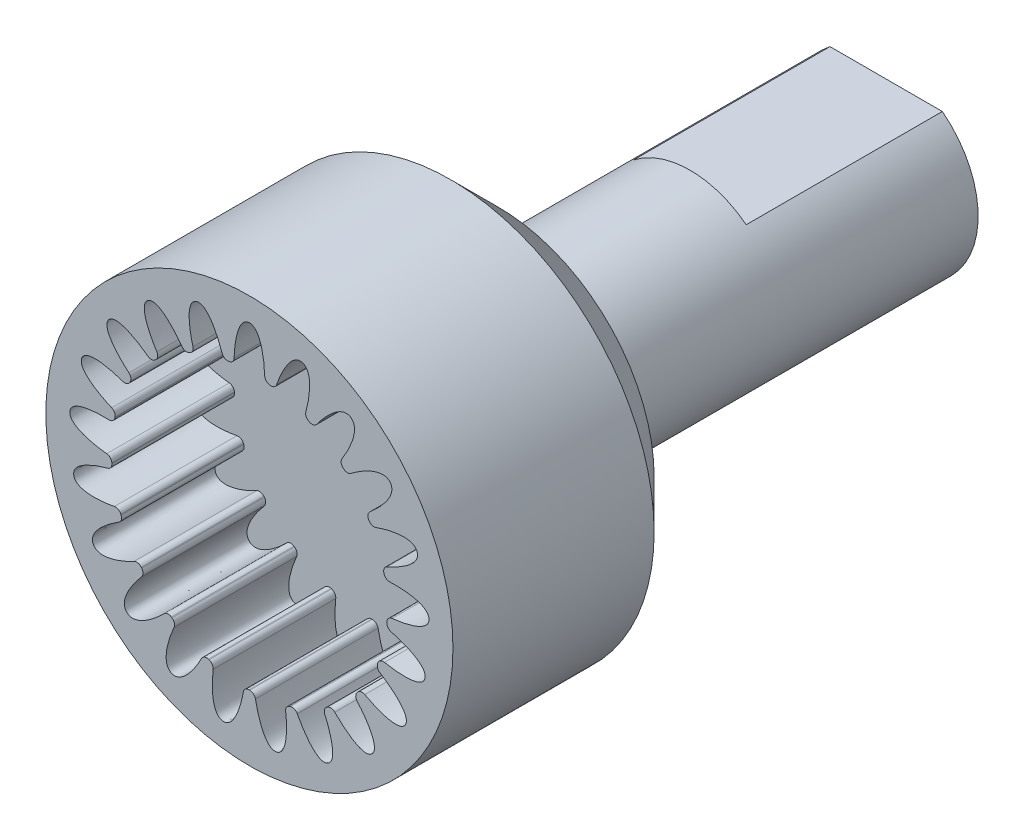
from build123d import *

# Parameters (mm, degrees)
BOSS_EXTRUDE1_DEPTH = 13
SKETCH2_R           = 6.096
BOSS_EXTRUDE2_DEPTH = 12.7
SKETCH3_R           = 13.49375
BOSS_EXTRUDE3_DEPTH = 16.51
SKETCH5_R           = 9.144
CUT_EXTRUDE1_DEPTH  = 8.128
CUT_EXTRUDE2_START  = -8.128
CUT_EXTRUDE2_DEPTH  = 8.128
CIRPATTERN1_COUNT   = 21
FILLET1_START       = 34.082
FILLET1_DEPTH       = 8.918
CHAMFER1_SIZE       = 3.175


with BuildPart() as part:
    # Sketch1 → Boss-Extrude1 (new body)
    with BuildSketch(Plane.XY):
        with BuildLine():
            Line((-3.724371088, 4.826), (3.724371088, 4.826))
            ThreePointArc((3.724371088, 4.826), (0, -6.096), (-3.724371088, 4.826))
        make_face()
    extrude(amount=BOSS_EXTRUDE1_DEPTH)

    # Sketch2 → Boss-Extrude2 (add)
    with BuildSketch(Plane.XY.offset(13)):
        with Locations(Location((0, 0, 0), (0, 0, 127.658462006))):
            Circle(SKETCH2_R)
    extrude(amount=BOSS_EXTRUDE2_DEPTH)

    # Sketch3 → Boss-Extrude3 (add)
    with BuildSketch(Plane.XY.offset(25.7)):
        Circle(SKETCH3_R)
    extrude(amount=BOSS_EXTRUDE3_DEPTH)

    # Sketch5 → Cut-Extrude1 (cut)
    with BuildSketch(Plane.XY.offset(42.21)):
        Circle(SKETCH5_R)
    extrude(amount=-CUT_EXTRUDE1_DEPTH, mode=Mode.SUBTRACT)

    # Cut-Extrude2: read off the stored shape, not the designer's step
    # Cut-Extrude2 outline → Cut-Extrude2 (cut)
    with BuildSketch(Plane.XY.offset(42.21).offset(CUT_EXTRUDE2_START)):
        with BuildLine():
            ThreePointArc((-1.015815211, 9.087400919), (0, 9.144), (1.015815211, 9.087400919))
            add(Edge.make_bspline(
                [(1.015815211, 9.087400919), (1.01593835, 9.106264626), (1.017118698, 9.467505157), (0.975400224, 10.171118531), (0.79844451, 11.055554394), (0.569275084, 11.580000245), (0.307569188, 11.86382226), (0.102523063, 11.938), (0, 11.938), (-0.102523063, 11.938), (-0.307569188, 11.86382226), (-0.569275084, 11.580000245), (-0.79844451, 11.055554394), (-0.975400224, 10.171118531), (-1.017118698, 9.467505157), (-1.01593835, 9.106264626), (-1.015815211, 9.087400919)],
                knots=[4.690747885, 4.690747885, 4.690747885, 4.690747885, 4.71238898, 5.105088062, 5.497787144, 5.890486225, 6.086835766, 6.283185307, 6.283185307, 6.283185307, 6.479534848, 6.675884389, 7.068583471, 7.461282552, 7.853981634, 7.875622729, 7.875622729, 7.875622729, 7.875622729], degree=3))
        make_face()
    cut_extrude2 = extrude(amount=CUT_EXTRUDE2_DEPTH, mode=Mode.SUBTRACT)

    # CirPattern1: Cut-Extrude2 ×21 about axis
    cirpattern1_axis = Axis((0, 0, 37.653), (0, 0, -1))
    for i in range(1, CIRPATTERN1_COUNT):
        add(cut_extrude2.rotate(cirpattern1_axis, i * 360 / CIRPATTERN1_COUNT), mode=Mode.SUBTRACT)

    # Fillet1: read off the stored shape, not the designer's step
    # Fillet1 outline → Fillet1 (cut)
    with BuildSketch(Plane.XY.offset(FILLET1_START)):
        with BuildLine():
            ThreePointArc((4.465281748, 8.345665619), (4.249646963, 8.200260063), (3.990955469, 8.227090035))
            ThreePointArc((3.990955469, 8.227090035), (4.136031053, 8.155120056), (4.279809299, 8.08059208))
            add(Edge.make_bspline(
                [(4.465281748, 8.345665619), (4.413065165, 8.273929717), (4.350865453, 8.185657198), (4.290333861, 8.096247373), (4.279809299, 8.08059208)],
                knots=[7.751779055, 7.751779055, 7.751779055, 7.751779055, 7.853981634, 7.875622729, 7.875622729, 7.875622729, 7.875622729], degree=3))
        make_face()
        with BuildLine():
            ThreePointArc((3.649243834, 8.384256404), (3.797156421, 8.318313478), (3.943877964, 8.249761366))
            ThreePointArc((3.943877964, 8.249761366), (3.761609939, 8.435286307), (3.740846491, 8.694535252))
            add(Edge.make_bspline(
                [(3.649243834, 8.384256404), (3.654921678, 8.402245753), (3.687084263, 8.505317371), (3.717317612, 8.60898408), (3.740846491, 8.694535252)],
                knots=[4.690747885, 4.690747885, 4.690747885, 4.690747885, 4.71238898, 4.814591559, 4.814591559, 4.814591559, 4.814591559], degree=3))
        make_face()
        with BuildLine():
            ThreePointArc((6.200322382, 6.720769179), (6.08083645, 6.95177621), (6.137410432, 7.205627586))
            add(Edge.make_bspline(
                [(5.958421128, 6.936133913), (5.969149175, 6.951650473), (6.030263759, 7.04066282), (6.089710224, 7.130812471), (6.137410432, 7.205627586)],
                knots=[4.690747885, 4.690747885, 4.690747885, 4.690747885, 4.71238898, 4.814591559, 4.814591559, 4.814591559, 4.814591559], degree=3))
            ThreePointArc((5.958421128, 6.936133913), (6.080325355, 6.829522646), (6.200322382, 6.720769179))
        make_face()
        with BuildLine():
            add(Edge.make_bspline(
                [(1.806973684, 9.291056012), (1.778221465, 9.207116027), (1.744803894, 9.104431521), (1.713315558, 9.001151924), (1.707873052, 8.983089983)],
                knots=[7.751779055, 7.751779055, 7.751779055, 7.751779055, 7.853981634, 7.875622729, 7.875622729, 7.875622729, 7.875622729], degree=3))
            ThreePointArc((1.806973684, 9.291056012), (1.643777987, 9.088550948), (1.388671157, 9.037938284))
            ThreePointArc((1.388671157, 9.037938284), (1.548514964, 9.011927508), (1.707873052, 8.983089983))
        make_face()
        with BuildLine():
            ThreePointArc((6.726829934, 6.658726211), (6.477916157, 6.583340085), (6.238625873, 6.685228733))
            ThreePointArc((6.238625873, 6.685228733), (6.356042633, 6.573694399), (6.471465708, 6.46009811))
            add(Edge.make_bspline(
                [(6.726829934, 6.658726211), (6.655788658, 6.605568443), (6.570333523, 6.53955131), (6.486137172, 6.471955714), (6.471465708, 6.46009811)],
                knots=[7.751779055, 7.751779055, 7.751779055, 7.751779055, 7.853981634, 7.875622729, 7.875622729, 7.875622729, 7.875622729], degree=3))
        make_face()
        with BuildLine():
            ThreePointArc((1.015815211, 9.087400919), (1.176593476, 9.067985652), (1.337002682, 9.045726053))
            ThreePointArc((1.337002682, 9.045726053), (1.108147877, 9.169284197), (1.011891923, 9.410895305))
            add(Edge.make_bspline(
                [(1.015815211, 9.087400919), (1.01593835, 9.106264626), (1.016291149, 9.214237149), (1.014625016, 9.322209673), (1.011891923, 9.410895305)],
                knots=[4.690747885, 4.690747885, 4.690747885, 4.690747885, 4.71238898, 4.814591559, 4.814591559, 4.814591559, 4.814591559], degree=3))
        make_face()
        with BuildLine():
            ThreePointArc((7.905840947, 4.594607156), (7.859753958, 4.850570289), (7.988638522, 5.076468287))
            add(Edge.make_bspline(
                [(7.738166556, 4.871705486), (7.752991573, 4.883370541), (7.837627857, 4.950414479), (7.921005359, 5.019036881), (7.988638522, 5.076468287)],
                knots=[4.690747885, 4.690747885, 4.690747885, 4.690747885, 4.71238898, 4.814591559, 4.814591559, 4.814591559, 4.814591559], degree=3))
            ThreePointArc((7.738166556, 4.871705486), (7.823230698, 4.733898756), (7.905840947, 4.594607156))
        make_face()
        with BuildLine():
            add(Edge.make_bspline(
                [(-1.011891923, 9.410895305), (-1.014625016, 9.322209673), (-1.016291149, 9.214237149), (-1.01593835, 9.106264626), (-1.015815211, 9.087400919)],
                knots=[7.751779055, 7.751779055, 7.751779055, 7.751779055, 7.853981634, 7.875622729, 7.875622729, 7.875622729, 7.875622729], degree=3))
            ThreePointArc((-1.011891923, 9.410895305), (-1.108147877, 9.169284197), (-1.337002682, 9.045726053))
            ThreePointArc((-1.337002682, 9.045726053), (-1.176593476, 9.067985652), (-1.015815211, 9.087400919))
        make_face()
        with BuildLine():
            ThreePointArc((8.39066976, 4.380129758), (8.130594073, 4.38146145), (7.931966991, 4.549355521))
            ThreePointArc((7.931966991, 4.549355521), (8.011291931, 4.408167146), (8.088103989, 4.265596073))
            add(Edge.make_bspline(
                [(8.39066976, 4.380129758), (8.307116122, 4.350273424), (8.205998627, 4.31237759), (8.105618731, 4.272602387), (8.088103989, 4.265596073)],
                knots=[7.751779055, 7.751779055, 7.751779055, 7.751779055, 7.853981634, 7.875622729, 7.875622729, 7.875622729, 7.875622729], degree=3))
        make_face()
        with BuildLine():
            ThreePointArc((-1.707873052, 8.983089983), (-1.548514964, 9.011927508), (-1.388671157, 9.037938284))
            ThreePointArc((-1.388671157, 9.037938284), (-1.643777987, 9.088550948), (-1.806973684, 9.291056012))
            add(Edge.make_bspline(
                [(-1.707873052, 8.983089983), (-1.713315558, 9.001151924), (-1.744803894, 9.104431521), (-1.778221465, 9.207116027), (-1.806973684, 9.291056012)],
                knots=[4.690747885, 4.690747885, 4.690747885, 4.690747885, 4.71238898, 4.814591559, 4.814591559, 4.814591559, 4.814591559], degree=3))
        make_face()
        with BuildLine():
            ThreePointArc((8.90889085, 2.060194124), (8.940297834, 2.318369913), (9.130041023, 2.496242504))
            add(Edge.make_bspline(
                [(8.830341928, 2.374404648), (8.847946646, 2.381181706), (8.948584326, 2.420300088), (9.048484407, 2.461297839), (9.130041023, 2.496242504)],
                knots=[4.690747885, 4.690747885, 4.690747885, 4.690747885, 4.71238898, 4.814591559, 4.814591559, 4.814591559, 4.814591559], degree=3))
            ThreePointArc((8.830341928, 2.374404648), (8.871007663, 2.217647188), (8.90889085, 2.060194124))
        make_face()
        with BuildLine():
            add(Edge.make_bspline(
                [(-3.740846491, 8.694535252), (-3.717317612, 8.60898408), (-3.687084263, 8.505317371), (-3.654921678, 8.402245753), (-3.649243834, 8.384256404)],
                knots=[7.751779055, 7.751779055, 7.751779055, 7.751779055, 7.853981634, 7.875622729, 7.875622729, 7.875622729, 7.875622729], degree=3))
            ThreePointArc((-3.740846491, 8.694535252), (-3.761609939, 8.435286307), (-3.943877964, 8.249761366))
            ThreePointArc((-3.943877964, 8.249761366), (-3.797156421, 8.318313478), (-3.649243834, 8.384256404))
        make_face()
        with BuildLine():
            ThreePointArc((9.308961755, 1.712339554), (9.060833024, 1.790270737), (8.920518033, 2.009252106))
            ThreePointArc((8.920518033, 2.009252106), (8.954702785, 1.850954898), (8.986078737, 1.692077106))
            add(Edge.make_bspline(
                [(9.308961755, 1.712339554), (9.220319862, 1.70843752), (9.112524741, 1.702030197), (9.004880495, 1.693609588), (8.986078737, 1.692077106)],
                knots=[7.751779055, 7.751779055, 7.751779055, 7.751779055, 7.853981634, 7.875622729, 7.875622729, 7.875622729, 7.875622729], degree=3))
        make_face()
        with BuildLine():
            ThreePointArc((-4.279809299, 8.08059208), (-4.136031053, 8.155120056), (-3.990955469, 8.227090035))
            ThreePointArc((-3.990955469, 8.227090035), (-4.249646963, 8.200260063), (-4.465281748, 8.345665619))
            add(Edge.make_bspline(
                [(-4.279809299, 8.08059208), (-4.290333861, 8.096247373), (-4.350865453, 8.185657198), (-4.413065165, 8.273929717), (-4.465281748, 8.345665619)],
                knots=[4.690747885, 4.690747885, 4.690747885, 4.690747885, 4.71238898, 4.814591559, 4.814591559, 4.814591559, 4.814591559], degree=3))
        make_face()
        with BuildLine():
            ThreePointArc((9.120346704, -0.657276196), (9.226457014, -0.419827805), (9.460199312, -0.305785381))
            add(Edge.make_bspline(
                [(9.137902668, -0.333872464), (9.156722831, -0.332585573), (9.264419806, -0.324868588), (9.371965907, -0.315138318), (9.460199312, -0.305785381)],
                knots=[4.690747885, 4.690747885, 4.690747885, 4.690747885, 4.71238898, 4.814591559, 4.814591559, 4.814591559, 4.814591559], degree=3))
            ThreePointArc((9.137902668, -0.333872464), (9.130556666, -0.495652065), (9.120346704, -0.657276196))
        make_face()
        with BuildLine():
            add(Edge.make_bspline(
                [(-6.137410432, 7.205627586), (-6.089710224, 7.130812471), (-6.030263759, 7.04066282), (-5.969149175, 6.951650473), (-5.958421128, 6.936133913)],
                knots=[7.751779055, 7.751779055, 7.751779055, 7.751779055, 7.853981634, 7.875622729, 7.875622729, 7.875622729, 7.875622729], degree=3))
            ThreePointArc((-6.137410432, 7.205627586), (-6.08083645, 6.95177621), (-6.200322382, 6.720769179))
            ThreePointArc((-6.200322382, 6.720769179), (-6.080325355, 6.829522646), (-5.958421128, 6.936133913))
        make_face()
        with BuildLine():
            ThreePointArc((9.400111648, -1.107599533), (9.185977199, -0.959993387), (9.116441901, -0.709382177))
            ThreePointArc((9.116441901, -0.709382177), (9.102448999, -0.870722816), (9.085600954, -1.031790337))
            add(Edge.make_bspline(
                [(9.400111648, -1.107599533), (9.31425772, -1.085200554), (9.209363042, -1.059550048), (9.10401911, -1.035867855), (9.085600954, -1.031790337)],
                knots=[7.751779055, 7.751779055, 7.751779055, 7.751779055, 7.853981634, 7.875622729, 7.875622729, 7.875622729, 7.875622729], degree=3))
        make_face()
        with BuildLine():
            ThreePointArc((-6.471465708, 6.46009811), (-6.356042633, 6.573694399), (-6.238625873, 6.685228733))
            ThreePointArc((-6.238625873, 6.685228733), (-6.477916157, 6.583340085), (-6.726829934, 6.658726211))
            add(Edge.make_bspline(
                [(-6.471465708, 6.46009811), (-6.486137172, 6.471955714), (-6.570333523, 6.53955131), (-6.655788658, 6.605568443), (-6.726829934, 6.658726211)],
                knots=[4.690747885, 4.690747885, 4.690747885, 4.690747885, 4.71238898, 4.814591559, 4.814591559, 4.814591559, 4.814591559], degree=3))
        make_face()
        with BuildLine():
            ThreePointArc((8.52141973, -3.316344643), (8.692804998, -3.12072198), (8.949777376, -3.080642892))
            add(Edge.make_bspline(
                [(8.633520656, -3.012483542), (8.651884009, -3.016801164), (8.757070931, -3.041171264), (8.862707107, -3.063573052), (8.949777376, -3.080642892)],
                knots=[4.690747885, 4.690747885, 4.690747885, 4.690747885, 4.71238898, 4.814591559, 4.814591559, 4.814591559, 4.814591559], degree=3))
            ThreePointArc((8.633520656, -3.012483542), (8.578815641, -3.164910457), (8.52141973, -3.316344643))
        make_face()
        with BuildLine():
            add(Edge.make_bspline(
                [(-7.988638522, 5.076468287), (-7.921005359, 5.019036881), (-7.837627857, 4.950414479), (-7.752991573, 4.883370541), (-7.738166556, 4.871705486)],
                knots=[7.751779055, 7.751779055, 7.751779055, 7.751779055, 7.853981634, 7.875622729, 7.875622729, 7.875622729, 7.875622729], degree=3))
            ThreePointArc((-7.988638522, 5.076468287), (-7.859753958, 4.850570289), (-7.905840947, 4.594607156))
            ThreePointArc((-7.905840947, 4.594607156), (-7.823230698, 4.733898756), (-7.738166556, 4.871705486))
        make_face()
        with BuildLine():
            ThreePointArc((8.656020368, -3.829123542), (8.494906988, -3.624957886), (8.502329899, -3.364984739))
            ThreePointArc((8.502329899, -3.364984739), (8.441402674, -3.515032986), (8.377827655, -3.663978682))
            add(Edge.make_bspline(
                [(8.656020368, -3.829123542), (8.580582905, -3.782413797), (8.487909022, -3.726984622), (8.394225675, -3.673303893), (8.377827655, -3.663978682)],
                knots=[7.751779055, 7.751779055, 7.751779055, 7.751779055, 7.853981634, 7.875622729, 7.875622729, 7.875622729, 7.875622729], degree=3))
        make_face()
        with BuildLine():
            ThreePointArc((-8.088103989, 4.265596073), (-8.011291931, 4.408167146), (-7.931966991, 4.549355521))
            ThreePointArc((-7.931966991, 4.549355521), (-8.130594073, 4.38146145), (-8.39066976, 4.380129758))
            add(Edge.make_bspline(
                [(-8.088103989, 4.265596073), (-8.105618731, 4.272602387), (-8.205998627, 4.31237759), (-8.307116122, 4.350273424), (-8.39066976, 4.380129758)],
                knots=[4.690747885, 4.690747885, 4.690747885, 4.690747885, 4.71238898, 4.814591559, 4.814591559, 4.814591559, 4.814591559], degree=3))
        make_face()
        with BuildLine():
            ThreePointArc((7.165327217, -5.680741314), (7.386759111, -5.544326312), (7.644128446, -5.581771764))
            add(Edge.make_bspline(
                [(7.362012445, -5.423422237), (7.378287325, -5.432960733), (7.471617874, -5.487252527), (7.565957889, -5.539795876), (7.644128446, -5.581771764)],
                knots=[4.690747885, 4.690747885, 4.690747885, 4.690747885, 4.71238898, 4.814591559, 4.814591559, 4.814591559, 4.814591559], degree=3))
            ThreePointArc((7.362012445, -5.423422237), (7.264809198, -5.552952666), (7.165327217, -5.680741314))
        make_face()
        with BuildLine():
            add(Edge.make_bspline(
                [(-9.130041023, 2.496242504), (-9.048484407, 2.461297839), (-8.948584326, 2.420300088), (-8.847946646, 2.381181706), (-8.830341928, 2.374404648)],
                knots=[7.751779055, 7.751779055, 7.751779055, 7.751779055, 7.853981634, 7.875622729, 7.875622729, 7.875622729, 7.875622729], degree=3))
            ThreePointArc((-9.130041023, 2.496242504), (-8.940297834, 2.318369913), (-8.90889085, 2.060194124))
            ThreePointArc((-8.90889085, 2.060194124), (-8.871007663, 2.217647188), (-8.830341928, 2.374404648))
        make_face()
        with BuildLine():
            ThreePointArc((7.142803693, -6.21041312), (7.049027012, -5.967828969), (7.132748573, -5.721593641))
            ThreePointArc((7.132748573, -5.721593641), (7.030300677, -5.847017051), (6.925647604, -5.970606441))
            add(Edge.make_bspline(
                [(7.142803693, -6.21041312), (7.084485643, -6.143542976), (7.012267037, -6.063260257), (6.938568451, -5.98435076), (6.925647604, -5.970606441)],
                knots=[7.751779055, 7.751779055, 7.751779055, 7.751779055, 7.853981634, 7.875622729, 7.875622729, 7.875622729, 7.875622729], degree=3))
        make_face()
        with BuildLine():
            ThreePointArc((-8.986078737, 1.692077106), (-8.954702785, 1.850954898), (-8.920518033, 2.009252106))
            ThreePointArc((-8.920518033, 2.009252106), (-9.060833024, 1.790270737), (-9.308961755, 1.712339554))
            add(Edge.make_bspline(
                [(-8.986078737, 1.692077106), (-9.004880495, 1.693609588), (-9.112524741, 1.702030197), (-9.220319862, 1.70843752), (-9.308961755, 1.712339554)],
                knots=[4.690747885, 4.690747885, 4.690747885, 4.690747885, 4.71238898, 4.814591559, 4.814591559, 4.814591559, 4.814591559], degree=3))
        make_face()
        with BuildLine():
            ThreePointArc((5.172563936, -7.54037919), (5.42436726, -7.47529292), (5.659265157, -7.586935719))
            add(Edge.make_bspline(
                [(5.436357121, -7.352466066), (5.449097432, -7.366377898), (5.52227878, -7.445767323), (5.596940108, -7.523783526), (5.659265157, -7.586935719)],
                knots=[4.690747885, 4.690747885, 4.690747885, 4.690747885, 4.71238898, 4.814591559, 4.814591559, 4.814591559, 4.814591559], degree=3))
            ThreePointArc((5.436357121, -7.352466066), (5.305292577, -7.447590662), (5.172563936, -7.54037919))
        make_face()
        with BuildLine():
            add(Edge.make_bspline(
                [(-9.460199312, -0.305785381), (-9.371965907, -0.315138318), (-9.264419806, -0.324868588), (-9.156722831, -0.332585573), (-9.137902668, -0.333872464)],
                knots=[7.751779055, 7.751779055, 7.751779055, 7.751779055, 7.853981634, 7.875622729, 7.875622729, 7.875622729, 7.875622729], degree=3))
            ThreePointArc((-9.460199312, -0.305785381), (-9.226457014, -0.419827805), (-9.120346704, -0.657276196))
            ThreePointArc((-9.120346704, -0.657276196), (-9.130556666, -0.495652065), (-9.137902668, -0.333872464))
        make_face()
        with BuildLine():
            ThreePointArc((4.994917563, -8.039880238), (4.976810051, -7.780432258), (5.129391235, -7.569813839))
            ThreePointArc((5.129391235, -7.569813839), (4.994525613, -7.659467991), (4.85809337, -7.746719616))
            add(Edge.make_bspline(
                [(4.994917563, -8.039880238), (4.958900742, -7.9587914), (4.913554353, -7.860788609), (4.86638897, -7.763661801), (4.85809337, -7.746719616)],
                knots=[7.751779055, 7.751779055, 7.751779055, 7.751779055, 7.853981634, 7.875622729, 7.875622729, 7.875622729, 7.875622729], degree=3))
        make_face()
        with BuildLine():
            ThreePointArc((-9.085600954, -1.031790337), (-9.102448999, -0.870722816), (-9.1164419, -0.709382177))
            ThreePointArc((-9.1164419, -0.709382177), (-9.185977199, -0.959993387), (-9.400111648, -1.107599533))
            add(Edge.make_bspline(
                [(-9.085600954, -1.031790337), (-9.10401911, -1.035867855), (-9.209363042, -1.059550048), (-9.31425772, -1.085200554), (-9.400111648, -1.107599533)],
                knots=[4.690747885, 4.690747885, 4.690747885, 4.690747885, 4.71238898, 4.814591559, 4.814591559, 4.814591559, 4.814591559], degree=3))
        make_face()
        with BuildLine():
            ThreePointArc((2.720195651, -8.730021284), (2.979996574, -8.742046947), (3.171551324, -8.91796714))
            add(Edge.make_bspline(
                [(3.027657609, -8.62821102), (3.03573132, -8.645260061), (3.082260982, -8.742693017), (3.130609638, -8.839249991), (3.171551324, -8.91796714)],
                knots=[4.690747885, 4.690747885, 4.690747885, 4.690747885, 4.71238898, 4.814591559, 4.814591559, 4.814591559, 4.814591559], degree=3))
            ThreePointArc((3.027657609, -8.62821102), (2.874377429, -8.680477544), (2.720195651, -8.730021284))
        make_face()
        with BuildLine():
            add(Edge.make_bspline(
                [(-8.949777376, -3.080642892), (-8.862707107, -3.063573052), (-8.757070931, -3.041171264), (-8.651884009, -3.016801164), (-8.633520656, -3.012483542)],
                knots=[7.751779055, 7.751779055, 7.751779055, 7.751779055, 7.853981634, 7.875622729, 7.875622729, 7.875622729, 7.875622729], degree=3))
            ThreePointArc((-8.949777376, -3.080642892), (-8.692804998, -3.12072198), (-8.52141973, -3.316344643))
            ThreePointArc((-8.52141973, -3.316344643), (-8.578815641, -3.164910457), (-8.633520656, -3.012483542))
        make_face()
        with BuildLine():
            ThreePointArc((2.403211089, -9.154968715), (2.462381677, -8.901709997), (2.670264977, -8.745422857))
            ThreePointArc((2.670264977, -8.745422857), (2.51496503, -8.791341587), (2.35887622, -8.834502758))
            add(Edge.make_bspline(
                [(2.403211089, -9.154968715), (2.392695749, -9.066866282), (2.378250802, -8.959851398), (2.361809474, -8.85313742), (2.35887622, -8.834502758)],
                knots=[7.751779055, 7.751779055, 7.751779055, 7.751779055, 7.853981634, 7.875622729, 7.875622729, 7.875622729, 7.875622729], degree=3))
        make_face()
        with BuildLine():
            ThreePointArc((-8.377827655, -3.663978682), (-8.441402674, -3.515032986), (-8.502329899, -3.364984739))
            ThreePointArc((-8.502329899, -3.364984739), (-8.494906988, -3.624957886), (-8.656020368, -3.829123542))
            add(Edge.make_bspline(
                [(-8.377827655, -3.663978682), (-8.394225675, -3.673303893), (-8.487909022, -3.726984622), (-8.580582905, -3.782413797), (-8.656020368, -3.829123542)],
                knots=[4.690747885, 4.690747885, 4.690747885, 4.690747885, 4.71238898, 4.814591559, 4.814591559, 4.814591559, 4.814591559], degree=3))
        make_face()
        with BuildLine():
            ThreePointArc((0.026126044, -9.143962677), (0.270840115, -9.23203174), (0.402031237, -9.456598046))
            add(Edge.make_bspline(
                [(0.349937433, -9.13730156), (0.352627158, -9.155972928), (0.36837077, -9.26279207), (0.386110762, -9.369310305), (0.402031237, -9.456598046)],
                knots=[4.690747885, 4.690747885, 4.690747885, 4.690747885, 4.71238898, 4.814591559, 4.814591559, 4.814591559, 4.814591559], degree=3))
            ThreePointArc((0.349937433, -9.13730156), (0.188061233, -9.142065903), (0.026126044, -9.143962677))
        make_face()
        with BuildLine():
            add(Edge.make_bspline(
                [(-7.644128446, -5.581771764), (-7.565957889, -5.539795876), (-7.471617874, -5.487252527), (-7.378287325, -5.432960733), (-7.362012445, -5.423422237)],
                knots=[7.751779055, 7.751779055, 7.751779055, 7.751779055, 7.853981634, 7.875622729, 7.875622729, 7.875622729, 7.875622729], degree=3))
            ThreePointArc((-7.644128446, -5.581771764), (-7.386759111, -5.544326312), (-7.165327217, -5.680741314))
            ThreePointArc((-7.165327217, -5.680741314), (-7.264809198, -5.552952666), (-7.362012445, -5.423422237))
        make_face()
        with BuildLine():
            ThreePointArc((-0.402031237, -9.456598046), (-0.270840115, -9.23203174), (-0.026126044, -9.143962677))
            ThreePointArc((-0.026126044, -9.143962677), (-0.188061233, -9.142065903), (-0.349937433, -9.13730156))
            add(Edge.make_bspline(
                [(-0.402031237, -9.456598046), (-0.386110762, -9.369310305), (-0.36837077, -9.26279207), (-0.352627158, -9.155972928), (-0.349937433, -9.13730156)],
                knots=[7.751779055, 7.751779055, 7.751779055, 7.751779055, 7.853981634, 7.875622729, 7.875622729, 7.875622729, 7.875622729], degree=3))
        make_face()
        with BuildLine():
            ThreePointArc((-6.925647604, -5.970606441), (-7.030300677, -5.847017051), (-7.132748573, -5.721593641))
            ThreePointArc((-7.132748573, -5.721593641), (-7.049027012, -5.967828969), (-7.142803693, -6.21041312))
            add(Edge.make_bspline(
                [(-6.925647604, -5.970606441), (-6.938568451, -5.98435076), (-7.012267037, -6.063260257), (-7.084485643, -6.143542976), (-7.142803693, -6.21041312)],
                knots=[4.690747885, 4.690747885, 4.690747885, 4.690747885, 4.71238898, 4.814591559, 4.814591559, 4.814591559, 4.814591559], degree=3))
        make_face()
        with BuildLine():
            ThreePointArc((-2.670264977, -8.745422857), (-2.462381677, -8.901709997), (-2.403211089, -9.154968715))
            add(Edge.make_bspline(
                [(-2.35887622, -8.834502758), (-2.361809474, -8.85313742), (-2.378250802, -8.959851398), (-2.392695749, -9.066866282), (-2.403211089, -9.154968715)],
                knots=[4.690747885, 4.690747885, 4.690747885, 4.690747885, 4.71238898, 4.814591559, 4.814591559, 4.814591559, 4.814591559], degree=3))
            ThreePointArc((-2.35887622, -8.834502758), (-2.51496503, -8.791341587), (-2.670264977, -8.745422857))
        make_face()
        with BuildLine():
            add(Edge.make_bspline(
                [(-5.659265157, -7.586935719), (-5.596940108, -7.523783526), (-5.52227878, -7.445767323), (-5.449097432, -7.366377898), (-5.436357121, -7.352466066)],
                knots=[7.751779055, 7.751779055, 7.751779055, 7.751779055, 7.853981634, 7.875622729, 7.875622729, 7.875622729, 7.875622729], degree=3))
            ThreePointArc((-5.659265157, -7.586935719), (-5.42436726, -7.47529292), (-5.172563936, -7.54037919))
            ThreePointArc((-5.172563936, -7.54037919), (-5.305292577, -7.447590662), (-5.436357121, -7.352466066))
        make_face()
        with BuildLine():
            ThreePointArc((-3.171551324, -8.91796714), (-2.979996574, -8.742046947), (-2.720195651, -8.730021284))
            ThreePointArc((-2.720195651, -8.730021284), (-2.874377429, -8.680477544), (-3.027657609, -8.62821102))
            add(Edge.make_bspline(
                [(-3.171551324, -8.91796714), (-3.130609638, -8.839249991), (-3.082260982, -8.742693017), (-3.03573132, -8.645260061), (-3.027657609, -8.62821102)],
                knots=[7.751779055, 7.751779055, 7.751779055, 7.751779055, 7.853981634, 7.875622729, 7.875622729, 7.875622729, 7.875622729], degree=3))
        make_face()
        with BuildLine():
            ThreePointArc((-4.85809337, -7.746719616), (-4.994525613, -7.659467991), (-5.129391235, -7.569813839))
            ThreePointArc((-5.129391235, -7.569813839), (-4.976810051, -7.780432258), (-4.994917563, -8.039880238))
            add(Edge.make_bspline(
                [(-4.85809337, -7.746719616), (-4.86638897, -7.763661801), (-4.913554353, -7.860788609), (-4.958900742, -7.9587914), (-4.994917563, -8.039880238)],
                knots=[4.690747885, 4.690747885, 4.690747885, 4.690747885, 4.71238898, 4.814591559, 4.814591559, 4.814591559, 4.814591559], degree=3))
        make_face()
    extrude(amount=FILLET1_DEPTH, mode=Mode.SUBTRACT)

    # Chamfer1
    chamfer1_edges = [part.edges().sort_by_distance(p)[0] for p in [
        (-13.49375, 0, 25.7),
    ]]
    chamfer(chamfer1_edges, length=CHAMFER1_SIZE)


solid = part.part
